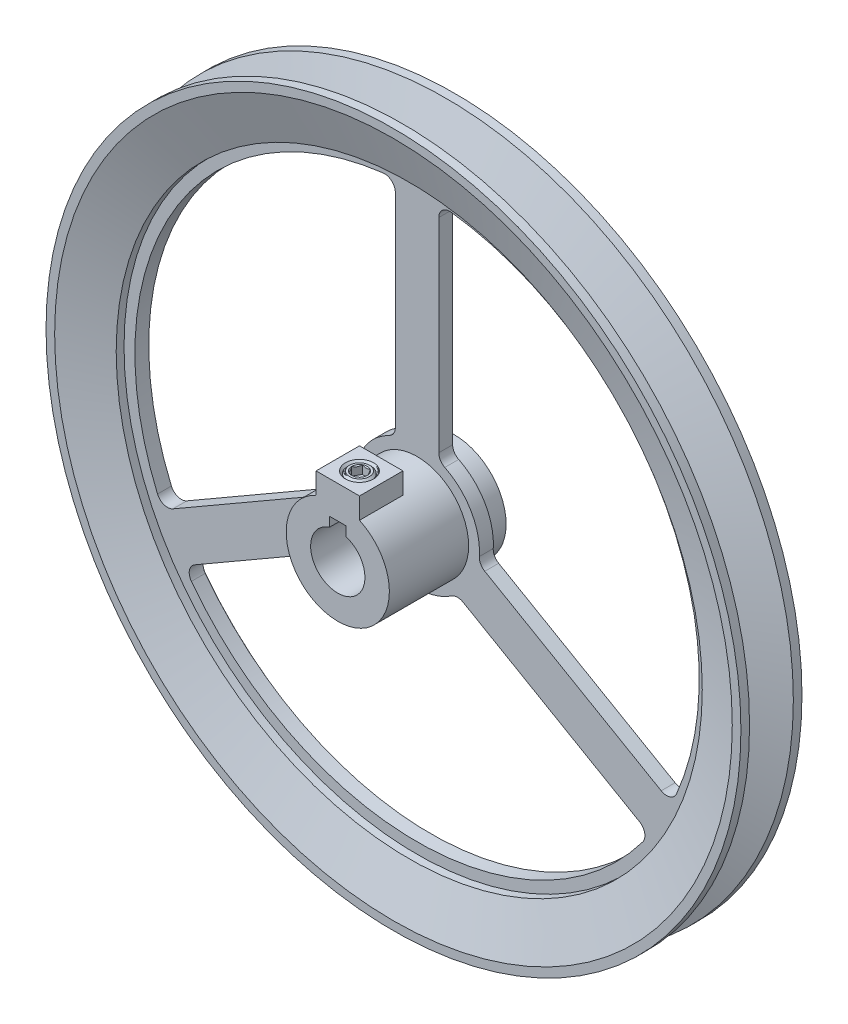
from build123d import *

# Parameters (mm, degrees)
CUT_EXTRUDE1_DEPTH       = 17.8562
CIRPATTERN1_COUNT        = 3
SKETCH3_R                = 7.9375
CUT_EXTRUDE2_DEPTH       = 34.1376
SKETCH4_W                = 4.7625
SKETCH4_H                = 4.7625
CUT_EXTRUDE3_DEPTH       = 34.1376
BOSS_EXTRUDE1_REACH      = 163.519
BOSS_EXTRUDE1_END_RADIUS = 15.08125
BOSS_EXTRUDE1_START      = 4.7625
SKETCH5_W                = 12.7
SKETCH5_H                = 12.7
SKETCH6_R                = 3.086805556
CUT_EXTRUDE4_DEPTH       = 19.84375
CUT_SWEEP1_PITCH         = 1.411111111
CUT_SWEEP2_PITCH         = 1.411111111
CUT_EXTRUDE6_DEPTH       = 2.48046875


with BuildPart() as part:
    # Sketch1 → Revolve1 (revolve)
    with BuildSketch(Plane(origin=(0, 0, 0), x_dir=(0, 0, -1), z_dir=(1, 0, 0)), mode=Mode.PRIVATE) as revolve1_sk:
        Polygon((6.401840172, 101.6), (8.9281, 101.6), (8.9281, 99.073740172), (4.319331533, 85.688904656), (2.028879483, 85.688904656), (2.028879483, 15.08125), (8.9281, 15.08125), (8.9281, 0), (-25.2095, 0), (-25.2095, 15.08125), (-8.54075, 15.08125), (-2.028879483, 15.08125), (-2.028879483, 85.688904656), (-4.319331533, 85.688904656), (-8.9281, 99.073740172), (-8.9281, 101.6), (-6.401840172, 101.6), (-2.028879483, 88.9), (2.028879483, 88.9), align=None)
    revolve(revolve1_sk.sketch.rotate(Axis((0, 0, 25.2095), (0, 0, -1)), 90), axis=Axis((0, 0, 25.2095), (0, 0, -1)))

    # Sketch2 → Cut-Extrude1 (cut)
    with BuildSketch(Plane(origin=(0, -7.9375, -8.9281), x_dir=(0, 1, 0), z_dir=(0, 0, 1))):
        with BuildLine():
            Line((-25.945773416, -71.387551083), (3.837635682, -19.801173302))
            ThreePointArc((3.837635682, -19.801173302), (5.087215575, -18.590375122), (6.787300956, -18.219980961))
            ThreePointArc((6.787300956, -18.219980961), (17.065625, -15.810376278), (24.291565891, -8.113888889))
            ThreePointArc((24.291565891, -8.113888889), (25.462379335, -6.826768841), (27.135751263, -6.35))
            Line((27.135751263, -6.35), (86.70256946, -6.35))
            ThreePointArc((86.70256946, -6.35), (89.078579808, -7.419008588), (89.85460561, -9.906173336))
            ThreePointArc((89.85460561, -9.906173336), (49.194452328, -71.459137598), (-24.442055041, -75.895381131))
            ThreePointArc((-24.442055041, -75.895381131), (-26.207989996, -73.979740698), (-25.945773416, -71.387551083))
        make_face()
    cut_extrude1 = extrude(amount=CUT_EXTRUDE1_DEPTH, mode=Mode.SUBTRACT)

    # CirPattern1: Cut-Extrude1 ×3 about axis
    cirpattern1_axis = Axis((0, 0, 0), (0, 0, 1))
    for i in range(1, CIRPATTERN1_COUNT):
        add(cut_extrude1.rotate(cirpattern1_axis, i * 360 / CIRPATTERN1_COUNT), mode=Mode.SUBTRACT)

    # Sketch3 → Cut-Extrude2 (cut)
    with BuildSketch(Plane(origin=(0, 0, -8.9281), x_dir=(-1, 0, 0), z_dir=(0, 0, -1))):
        with Locations(Location((0, 0, 0), (0, 0, 90))):
            Circle(SKETCH3_R)
    extrude(amount=-CUT_EXTRUDE2_DEPTH, mode=Mode.SUBTRACT)

    # Sketch4 → Cut-Extrude3 (cut)
    with BuildSketch(Plane(origin=(0, 0, -8.9281), x_dir=(-1, 0, 0), z_dir=(0, 0, -1))):
        with Locations((0, 7.9375)):
            Rectangle(SKETCH4_W, SKETCH4_H)
    extrude(amount=-CUT_EXTRUDE3_DEPTH, mode=Mode.SUBTRACT)

    # Boss-Extrude1: up to this cylinder (the profile starts outside it)
    boss_extrude1_end = Plane(origin=(0, 0, 18.8595), z_dir=(0, 0, 1)) * Cylinder(BOSS_EXTRUDE1_END_RADIUS, 358.2005, mode=Mode.PRIVATE)
    # Sketch5 → Boss-Extrude1 (add, up to the surface)
    with BuildSketch(Plane(origin=(0, 15.08125, 0), x_dir=(-1, 0, 0), z_dir=(0, 1, 0)).offset(BOSS_EXTRUDE1_START), mode=Mode.PRIVATE) as boss_extrude1_sk1:
        with Locations((0, 18.8595)):
            Rectangle(SKETCH5_W, SKETCH5_H)
    boss_extrude1_tool1 = extrude(boss_extrude1_sk1.sketch, amount=-BOSS_EXTRUDE1_REACH, mode=Mode.PRIVATE) - boss_extrude1_end
    add(boss_extrude1_tool1.solids().sort_by_distance((0, 19.84375, 18.8595))[0])

    # Sketch6 → Cut-Extrude4 (cut)
    with BuildSketch(Plane(origin=(0, 19.84375, 0), x_dir=(-1, 0, 0), z_dir=(0, 1, 0))):
        with Locations(Location((0, 18.8595, 0), (0, 0, 90))):
            Circle(SKETCH6_R)
    extrude(amount=-CUT_EXTRUDE4_DEPTH, mode=Mode.SUBTRACT)

    # Cut-Sweep1: arcs per turn and ends read off the stored shape
    # Cut-Sweep1: the profile of Sketch8 screwed along a right-hand helix through 11.6875 turns, 8 arcs to a turn; built about Z, then put on its axis
    cut_sweep1_z = Axis((0, 0, 0), (0, 0, 1))
    cut_sweep1_corners = [(2.975827818, 0, -1.367013889), (2.975827818, 0, -0.044097222), (3.96875, 0, -0.617361111), (3.96875, 0, -0.79375)]
    with BuildLine(mode=Mode.PRIVATE) as cut_sweep1_profile:
        Line(cut_sweep1_corners[0], cut_sweep1_corners[1])
        Line(cut_sweep1_corners[1], cut_sweep1_corners[2])
        Line(cut_sweep1_corners[2], cut_sweep1_corners[3])
        Line(cut_sweep1_corners[3], cut_sweep1_corners[0])
    cut_sweep1_cap = Face(cut_sweep1_profile.wire())
    cut_sweep1_turn_angles = [0, 22.5, 45, 67.5, 90, 112.5, 135, 157.5, 180, 202.5, 225, 247.5, 270, 292.5, 315, 337.5, 360]
    cut_sweep1_turn_weights = [1, 0.9238795325112867, 1, 0.9238795325112867, 1, 0.9238795325112867, 1, 0.9238795325112867, 1, 0.9238795325112867, 1, 0.9238795325112867, 1, 0.9238795325112867, 1, 0.9238795325112867, 1]
    cut_sweep1_turn_rails = [Edge.make_bspline([Vector(p[0], p[1], 0).rotate(cut_sweep1_z, cut_sweep1_turn_angles[k]) / cut_sweep1_turn_weights[k] + Vector(0, 0, p[2] + CUT_SWEEP1_PITCH * cut_sweep1_turn_angles[k] / 360) for k in range(17)], [0, 0, 0, 1, 1, 2, 2, 3, 3, 4, 4, 5, 5, 6, 6, 7, 7, 8, 8, 8], 2, cut_sweep1_turn_weights) for p in cut_sweep1_corners]
    cut_sweep1_turn_sides = [Face.make_surface_from_curves(cut_sweep1_turn_rails[p[0]], cut_sweep1_turn_rails[p[1]]) for p in [(0, 1), (1, 2), (2, 3), (3, 0)]]
    cut_sweep1_last_angles = [3960, 3982.5, 4005, 4027.5, 4050, 4072.5, 4095, 4117.5, 4140, 4162.5, 4185, 4196.25, 4207.5]
    cut_sweep1_last_weights = [1, 0.9238795325112867, 1, 0.9238795325112867, 1, 0.9238795325112867, 1, 0.9238795325112867, 1, 0.9238795325112867, 1, 0.9807852804032366, 1]
    cut_sweep1_last_rails = [Edge.make_bspline([Vector(p[0], p[1], 0).rotate(cut_sweep1_z, cut_sweep1_last_angles[k]) / cut_sweep1_last_weights[k] + Vector(0, 0, p[2] + CUT_SWEEP1_PITCH * cut_sweep1_last_angles[k] / 360) for k in range(13)], [0, 0, 0, 1, 1, 2, 2, 3, 3, 4, 4, 5, 5, 6, 6, 6], 2, cut_sweep1_last_weights) for p in cut_sweep1_corners]
    cut_sweep1_last_sides = [Face.make_surface_from_curves(cut_sweep1_last_rails[p[0]], cut_sweep1_last_rails[p[1]]) for p in [(0, 1), (1, 2), (2, 3), (3, 0)]]
    cut_sweep1 = Plane(origin=(0, 19.84375, 18.8595), x_dir=(0, 0, 1), z_dir=(0, -1, 0)) * Solid(Shell([*[p.moved(Location((0, 0, CUT_SWEEP1_PITCH * i))) for i in range(11) for p in cut_sweep1_turn_sides], *cut_sweep1_last_sides, cut_sweep1_cap, cut_sweep1_cap.rotate(cut_sweep1_z, 4207.5).moved(Location((0, 0, CUT_SWEEP1_PITCH * 4207.5 / 360)))]))
    add(cut_sweep1, mode=Mode.SUBTRACT)

    # Cut-Extrude5 cone 1 section (through the dimple's axis) → Cut-Extrude5 (revolve, cut)
    with BuildSketch(Plane(origin=(0, 19.84375, 18.8595), x_dir=(0, 0, 1), z_dir=(1, 0, 0))):
        Polygon((0, 0), (4.121507259, 0), (0, 4.121507259), align=None)
    revolve(axis=Axis((0, 19.84375, 18.8595), (0, -1, 0)), mode=Mode.SUBTRACT)


with BuildPart() as body_2:
    # Sketch10 → Revolve3 (revolve)
    with BuildSketch(Plane(origin=(0, 0, 0), x_dir=(0, 0, -1), z_dir=(1, 0, 0))):
        Polygon((-22.82825, 11.388050811), (-22.82825, 18.774449189), (-21.758949189, 19.84375), (-18.8595, 19.84375), (-18.8595, 10.31875), (-21.758949189, 10.31875), align=None)
    revolve(axis=Axis((0, 19.84375, 18.8595), (0, -1, 0)))

    # Cut-Sweep2: arcs per turn and ends read off the stored shape
    # Cut-Sweep2: the profile of Sketch12 screwed along a right-hand helix through 7.75 turns, 8 arcs to a turn; built about Z, then put on its axis
    cut_sweep2_z = Axis((0, 0, 0), (0, 0, 1))
    cut_sweep2_corners = [(4.045128629, 0, -0.661458333), (4.045128629, 0, 0.661458333), (3.052206448, 0, 0.088194444), (3.052206448, 0, -0.088194444)]
    with BuildLine(mode=Mode.PRIVATE) as cut_sweep2_profile:
        Line(cut_sweep2_corners[0], cut_sweep2_corners[1])
        Line(cut_sweep2_corners[1], cut_sweep2_corners[2])
        Line(cut_sweep2_corners[2], cut_sweep2_corners[3])
        Line(cut_sweep2_corners[3], cut_sweep2_corners[0])
    cut_sweep2_cap = Face(cut_sweep2_profile.wire())
    cut_sweep2_turn_angles = [0, 22.5, 45, 67.5, 90, 112.5, 135, 157.5, 180, 202.5, 225, 247.5, 270, 292.5, 315, 337.5, 360]
    cut_sweep2_turn_weights = [1, 0.9238795325112867, 1, 0.9238795325112867, 1, 0.9238795325112867, 1, 0.9238795325112867, 1, 0.9238795325112867, 1, 0.9238795325112867, 1, 0.9238795325112867, 1, 0.9238795325112867, 1]
    cut_sweep2_turn_rails = [Edge.make_bspline([Vector(p[0], p[1], 0).rotate(cut_sweep2_z, cut_sweep2_turn_angles[k]) / cut_sweep2_turn_weights[k] + Vector(0, 0, p[2] + CUT_SWEEP2_PITCH * cut_sweep2_turn_angles[k] / 360) for k in range(17)], [0, 0, 0, 1, 1, 2, 2, 3, 3, 4, 4, 5, 5, 6, 6, 7, 7, 8, 8, 8], 2, cut_sweep2_turn_weights) for p in cut_sweep2_corners]
    cut_sweep2_turn_sides = [Face.make_surface_from_curves(cut_sweep2_turn_rails[p[0]], cut_sweep2_turn_rails[p[1]]) for p in [(0, 1), (1, 2), (2, 3), (3, 0)]]
    cut_sweep2_last_angles = [2520, 2542.5, 2565, 2587.5, 2610, 2632.5, 2655, 2677.5, 2700, 2722.5, 2745, 2767.5, 2790]
    cut_sweep2_last_weights = [1, 0.9238795325112867, 1, 0.9238795325112867, 1, 0.9238795325112867, 1, 0.9238795325112867, 1, 0.9238795325112867, 1, 0.9238795325112761, 1]
    cut_sweep2_last_rails = [Edge.make_bspline([Vector(p[0], p[1], 0).rotate(cut_sweep2_z, cut_sweep2_last_angles[k]) / cut_sweep2_last_weights[k] + Vector(0, 0, p[2] + CUT_SWEEP2_PITCH * cut_sweep2_last_angles[k] / 360) for k in range(13)], [0, 0, 0, 1, 1, 2, 2, 3, 3, 4, 4, 5, 5, 6, 6, 6], 2, cut_sweep2_last_weights) for p in cut_sweep2_corners]
    cut_sweep2_last_sides = [Face.make_surface_from_curves(cut_sweep2_last_rails[p[0]], cut_sweep2_last_rails[p[1]]) for p in [(0, 1), (1, 2), (2, 3), (3, 0)]]
    cut_sweep2 = Plane(origin=(0, 19.84375, 18.8595), x_dir=(0, 0, 1), z_dir=(0, -1, 0)) * Solid(Shell([*[p.moved(Location((0, 0, CUT_SWEEP2_PITCH * i))) for i in range(7) for p in cut_sweep2_turn_sides], *cut_sweep2_last_sides, cut_sweep2_cap, cut_sweep2_cap.rotate(cut_sweep2_z, 2790).moved(Location((0, 0, CUT_SWEEP2_PITCH * 2790 / 360)))]))
    add(cut_sweep2, mode=Mode.SUBTRACT)

    # Sketch13 → Cut-Extrude6 (cut)
    with BuildSketch(Plane(origin=(0, 19.84375, 0), x_dir=(1, 0, 0), z_dir=(0, 1, 0))):
        Polygon((2.291358881, -18.8595), (1.14567944, -16.875125), (-1.14567944, -16.875125), (-2.291358881, -18.8595), (-1.14567944, -20.843875), (1.14567944, -20.843875), align=None)
    extrude(amount=-CUT_EXTRUDE6_DEPTH, mode=Mode.SUBTRACT)

    # Cut-Extrude7 cone 1 section (through the dimple's axis) → Cut-Extrude7 (revolve, cut)
    with BuildSketch(Plane(origin=(0, 19.84375, 18.8595), x_dir=(0, 0, 1), z_dir=(1, 0, 0))):
        Polygon((0, 0), (2.291358881, 0), (0, 2.291358881), align=None)
    revolve(axis=Axis((0, 19.84375, 18.8595), (0, -1, 0)), mode=Mode.SUBTRACT)


solid = Compound([part.part, body_2.part])
